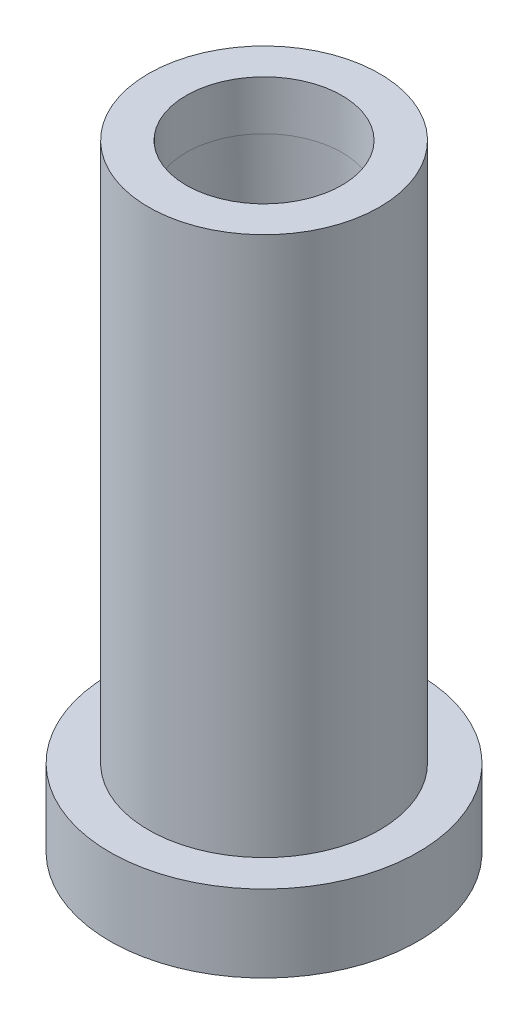
from build123d import *

# Parameters (mm, degrees)
CUT_EXTRUDE1_REACH = 44.426
SKETCH2_R          = 5.05


with BuildPart() as part:
    # Sketch1 → Revolve1 (revolve)
    with BuildSketch(Plane.XY):
        Polygon((0, 0), (10, 0), (10, 5), (7.5, 5), (7.5, 40), (0, 40), align=None)
    revolve(axis=Axis((0, 45, 0), (0, -1, 0)))

    # Sketch2 → Cut-Extrude1 (cut, up to next)
    with BuildSketch(Plane(origin=(0, 40, 0), x_dir=(1, 0, 0), z_dir=(0, 1, 0)), mode=Mode.PRIVATE) as cut_extrude1_sk1:
        Circle(SKETCH2_R)
    cut_extrude1_tool1 = extrude(cut_extrude1_sk1.sketch, amount=-CUT_EXTRUDE1_REACH, mode=Mode.PRIVATE) & part.part
    add(cut_extrude1_tool1.solids().sort_by_distance((0, 40, 0))[0], mode=Mode.SUBTRACT)

    # Cut-Sweep1: sweep along a path in Sketch4
    with BuildLine(Plane(origin=(0, 40, 0), x_dir=(1, 0, 0), z_dir=(0, 1, 0))) as cut_sweep1_path:
        CenterArc((0, 0), 5.05, 0, 360)
    # Sketch3 → Cut-Sweep1 (sweep, cut)
    with BuildSketch(Plane.XY):
        Polygon((5.05, 36.8), (6.013641914, 0), (5.05, 0), align=None)
    sweep(path=cut_sweep1_path.line, mode=Mode.SUBTRACT)


solid = part.part
